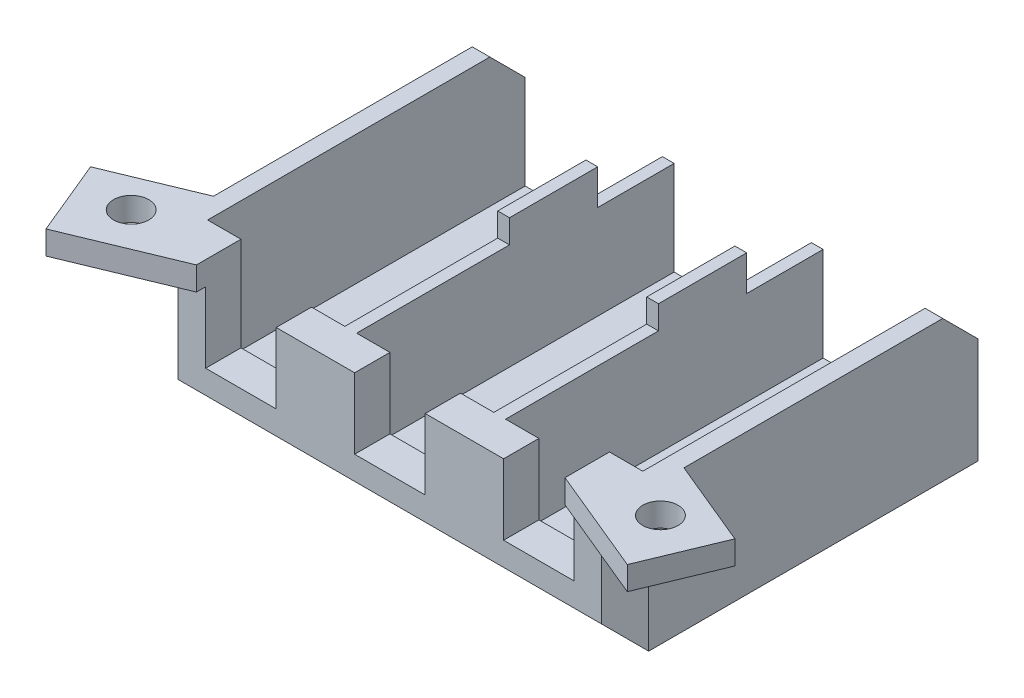
from build123d import *

# Parameters (mm, degrees)
SKETCH1_W           = 40
SKETCH1_H           = 30
BOSS_EXTRUDE1_DEPTH = 10
SKETCH5_W           = 40
SKETCH5_H           = 27
BOSS_EXTRUDE2_DEPTH = 3
SKETCH2_W           = 11.666666667
SKETCH2_H           = 27
SKETCH2_W_2         = 11.666666666
CUT_EXTRUDE1_DEPTH  = 11
SKETCH4_W           = 6
SKETCH4_H           = 3
CUT_EXTRUDE2_DEPTH  = 8
SKETCH6_W           = 19.333333334
SKETCH6_H           = 16
CUT_EXTRUDE3_DEPTH  = 2
CHAMFER2_SIZE       = 3
BOSS_EXTRUDE3_DEPTH = 2
SKETCH9_R           = 1.5
CUT_EXTRUDE5_DEPTH  = 2
SKETCH11_W          = 40
SKETCH11_H          = 30
CUT_EXTRUDE6_DEPTH  = 1
CHAMFER3_SIZE       = 2
SKETCH14_W          = 6
SKETCH14_H          = 2
BOSS_EXTRUDE4_DEPTH = 4
SKETCH15_R          = 1.5
CUT_EXTRUDE7_DEPTH  = 4
CHAMFER7_SIZE       = 4
SKETCH16_W          = 13.666666666
SKETCH16_H          = 6.5
CUT_EXTRUDE8_DEPTH  = 3


with BuildPart() as part:
    # Sketch1 → Boss-Extrude1 (new body)
    with BuildSketch(Plane(origin=(0, 0, 0), x_dir=(1, 0, 0), z_dir=(0, 1, 0))):
        Rectangle(SKETCH1_W, SKETCH1_H)
    extrude(amount=BOSS_EXTRUDE1_DEPTH)

    # Sketch5 → Boss-Extrude2 (add)
    with BuildSketch(Plane(origin=(0, 10, 0), x_dir=(1, 0, 0), z_dir=(0, 1, 0))):
        with Locations((0, -1.5)):
            Rectangle(SKETCH5_W, SKETCH5_H)
    extrude(amount=BOSS_EXTRUDE2_DEPTH)

    # Sketch2 → Cut-Extrude1 (cut)
    with BuildSketch(Plane(origin=(0, 13, 0), x_dir=(1, 0, 0), z_dir=(0, 1, 0))):
        with Locations((-12.666666666, 1.5)):
            Rectangle(SKETCH2_W, SKETCH2_H)
        with Locations((0, 1.5)):
            Rectangle(SKETCH2_W_2, SKETCH2_H)
        with Locations((12.666666666, 1.5)):
            Rectangle(SKETCH2_W, SKETCH2_H)
    extrude(amount=-CUT_EXTRUDE1_DEPTH, mode=Mode.SUBTRACT)

    # Sketch4 → Cut-Extrude2 (cut)
    with BuildSketch(Plane(origin=(0, 13, 0), x_dir=(1, 0, 0), z_dir=(0, 1, 0))):
        with Locations((-12.666666667, -13.5)):
            Rectangle(SKETCH4_W, SKETCH4_H)
        with Locations((0, -13.5)):
            Rectangle(SKETCH4_W, SKETCH4_H)
        with Locations((12.666666667, -13.5)):
            Rectangle(SKETCH4_W, SKETCH4_H)
    extrude(amount=-CUT_EXTRUDE2_DEPTH, mode=Mode.SUBTRACT)

    # Sketch6 → Cut-Extrude3 (cut)
    with BuildSketch(Plane(origin=(0, 13, 0), x_dir=(1, 0, 0), z_dir=(0, 1, 0))):
        with Locations((0, -7)):
            Rectangle(SKETCH6_W, SKETCH6_H)
    extrude(amount=-CUT_EXTRUDE3_DEPTH, mode=Mode.SUBTRACT)

    # Chamfer2
    chamfer2_edges = [part.edges().sort_by_distance(p)[0] for p in [
        (19.25, 10, -12),
        (6.333333333, 10, -12),
        (-6.333333333, 10, -12),
        (-19.25, 10, -12),
    ]]
    chamfer(chamfer2_edges, length=CHAMFER2_SIZE - 0.0001)  # a hair under: the kernel refuses the full size

    # Sketch8 → Boss-Extrude3 (add)
    with BuildSketch(Plane(origin=(0, 13, 0), x_dir=(1, 0, 0), z_dir=(0, 1, 0))):
        Polygon((20, -10), (27.39103626, -13.061467459), (24.712252234, -19.528624186), (15.666666667, -15.781819965), (15.666666667, -15), (18.5, -12), align=None)
    boss_extrude3 = extrude(amount=-BOSS_EXTRUDE3_DEPTH)

    # Mirror1: Boss-Extrude3 across plane
    add(boss_extrude3.mirror(Plane(origin=(0, 0, 0), x_dir=(0, 0, 1), z_dir=(1, 0, 0))))

    # Sketch9 → Cut-Extrude5 (cut)
    with BuildSketch(Plane.XZ.offset(-11)):
        with Locations(Location((-22.5, 14.5, 0), (0, 0, 270))):
            Circle(SKETCH9_R)
        with Locations(Location((22.5, 14.5, 0), (0, 0, 270))):
            Circle(SKETCH9_R)
    extrude(amount=-CUT_EXTRUDE5_DEPTH, mode=Mode.SUBTRACT)

    # Sketch11 → Cut-Extrude6 (cut)
    with BuildSketch(Plane.XZ):
        Rectangle(SKETCH11_W, SKETCH11_H)
    extrude(amount=-CUT_EXTRUDE6_DEPTH, mode=Mode.SUBTRACT)

    # Chamfer3
    chamfer3_edges = [part.edges().sort_by_distance(p)[0] for p in [
        (20, 6, 15),
        (-20, 6, 15),
        (0, 1, 15),
    ]]
    chamfer(chamfer3_edges, length=CHAMFER3_SIZE)

    # Sketch14 → Boss-Extrude4 (add)
    with BuildSketch(Plane.XZ.offset(-1)):
        with Locations((0, -14)):
            Rectangle(SKETCH14_W, SKETCH14_H)
    extrude(amount=BOSS_EXTRUDE4_DEPTH)

    # Sketch15 → Cut-Extrude7 (cut)
    with BuildSketch(Plane(origin=(0, 0, -15), x_dir=(-1, 0, 0), z_dir=(0, 0, -1))):
        with Locations((0, -0.5)):
            Circle(SKETCH15_R)
    extrude(amount=-CUT_EXTRUDE7_DEPTH, mode=Mode.SUBTRACT)

    # Chamfer7
    chamfer7_edges = [part.edges().sort_by_distance(p)[0] for p in [
        (3, 1, -14),
        (-3, 1, -14),
    ]]
    chamfer(chamfer7_edges, length=CHAMFER7_SIZE - 0.0001)  # a hair under: the kernel refuses the full size

    # Sketch16 → Cut-Extrude8 (cut)
    with BuildSketch(Plane(origin=(0, 13, 0), x_dir=(1, 0, 0), z_dir=(0, 1, 0))):
        with Locations((0, 11.75)):
            Rectangle(SKETCH16_W, SKETCH16_H)
    extrude(amount=-CUT_EXTRUDE8_DEPTH, mode=Mode.SUBTRACT)


solid = part.part
